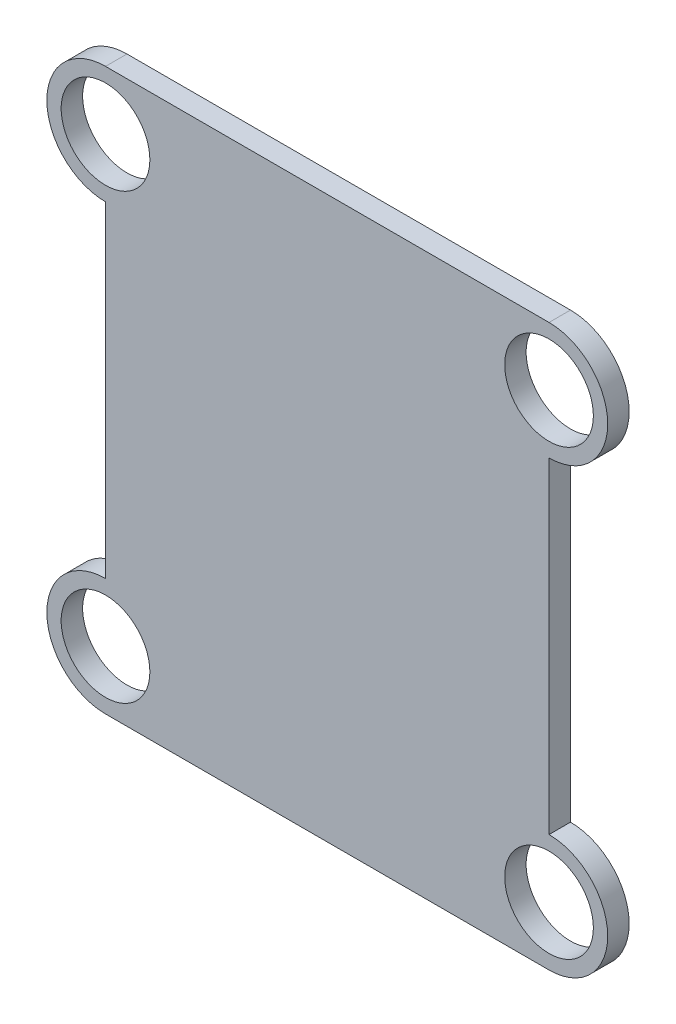
from build123d import *

# Parameters (mm, degrees)
SKETCH1_R      = 3.1
EXTRUDE1_DEPTH = 1.5


with BuildPart() as part:
    # Sketch1 → Extrude1 (new body)
    with BuildSketch(Plane.XY):
        with BuildLine():
            Line((15.5, 19.6), (-15.5, 19.6))
            ThreePointArc((-15.5, 19.6), (-19.6, 15.5), (-15.5, 11.4))
            Line((-15.5, 11.4), (-15.5, -11.4))
            ThreePointArc((-15.5, -11.4), (-19.6, -15.5), (-15.5, -19.6))
            Line((-15.5, -19.6), (15.5, -19.6))
            ThreePointArc((15.5, -19.6), (19.6, -15.5), (15.5, -11.4))
            Line((15.5, -11.4), (15.5, 11.4))
            ThreePointArc((15.5, 11.4), (19.6, 15.5), (15.5, 19.6))
        make_face()
        with Locations((15.5, 15.5)):
            Circle(SKETCH1_R, mode=Mode.SUBTRACT)
        with Locations((15.5, -15.5)):
            Circle(SKETCH1_R, mode=Mode.SUBTRACT)
        with Locations((-15.5, -15.5)):
            Circle(SKETCH1_R, mode=Mode.SUBTRACT)
        with Locations((-15.5, 15.5)):
            Circle(SKETCH1_R, mode=Mode.SUBTRACT)
    extrude(amount=EXTRUDE1_DEPTH)


solid = part.part
